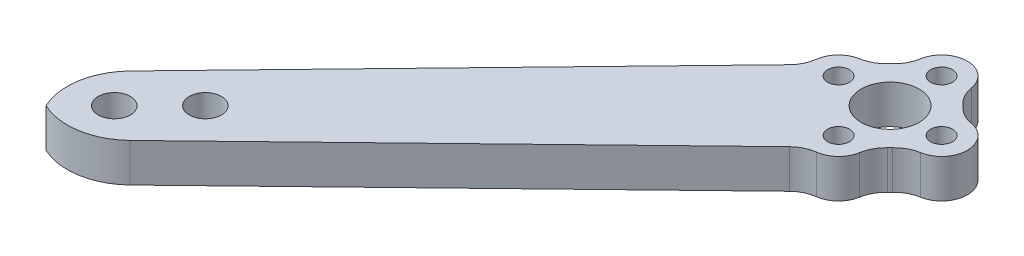
from build123d import *

# Parameters (mm, degrees)
SKETCH2_R               = 1.7
SKETCH2_R_2             = 4.5
BOSS_EXTRUDE1_DEPTH     = 6
FILLET1_R               = 10
CUT_EXTRUDE2_DEPTH      = 138.309868546
CUT_EXTRUDE2_DEPTH_BACK = 138.309868546
SKETCH7_R               = 2.5


with BuildPart() as part:
    # Sketch2 → Boss-Extrude1 (new body)
    with BuildSketch(Plane(origin=(0, 0, 0), x_dir=(1, 0, 0), z_dir=(0, 1, 0))):
        with BuildLine():
            Line((82.701229094, 71.670763572), (23.580603164, 14.468001358))
            Line((23.580603164, 14.468001358), (14.468001358, 23.580603164))
            Line((14.468001358, 23.580603164), (71.670763572, 82.701229094))
            ThreePointArc((71.670763572, 82.701229094), (72.579468699, 84.002771186), (73.034411761, 85.523555075))
            ThreePointArc((73.034411761, 85.523555075), (74.120868496, 87.776797037), (76.333333333, 88.944053189))
            ThreePointArc((76.333333333, 88.944053189), (77.868327334, 89.470595445), (79.153846154, 90.460996723))
            ThreePointArc((79.153846154, 90.460996723), (79.343145751, 90.656854249), (79.539003277, 90.846153846))
            ThreePointArc((79.539003277, 90.846153846), (80.529404555, 92.131672666), (81.055946811, 93.666666667))
            ThreePointArc((81.055946811, 93.666666667), (85, 97), (88.944053189, 93.666666667))
            ThreePointArc((88.944053189, 93.666666667), (89.470595445, 92.131672666), (90.460996723, 90.846153846))
            ThreePointArc((90.460996723, 90.846153846), (90.656854249, 90.656854249), (90.846153846, 90.460996723))
            ThreePointArc((90.846153846, 90.460996723), (92.131672666, 89.470595445), (93.666666667, 88.944053189))
            ThreePointArc((93.666666667, 88.944053189), (97, 85), (93.666666667, 81.055946811))
            ThreePointArc((93.666666667, 81.055946811), (92.131672666, 80.529404555), (90.846153846, 79.539003277))
            ThreePointArc((90.846153846, 79.539003277), (90.656854249, 79.343145751), (90.460996723, 79.153846154))
            ThreePointArc((90.460996723, 79.153846154), (89.470595445, 77.868327334), (88.944053189, 76.333333333))
            ThreePointArc((88.944053189, 76.333333333), (87.776797037, 74.120868496), (85.523555075, 73.034411761))
            ThreePointArc((85.523555075, 73.034411761), (84.002771186, 72.579468699), (82.701229094, 71.670763572))
        make_face()
        with Locations(Location((85, 93, 0), (0, 0, 270))):
            Circle(SKETCH2_R, mode=Mode.SUBTRACT)
        with Locations(Location((93, 85, 0), (0, 0, 270))):
            Circle(SKETCH2_R, mode=Mode.SUBTRACT)
        with Locations(Location((85, 77, 0), (0, 0, 270))):
            Circle(SKETCH2_R, mode=Mode.SUBTRACT)
        with Locations(Location((77, 85, 0), (0, 0, 270))):
            Circle(SKETCH2_R, mode=Mode.SUBTRACT)
        with Locations(Location((85, 85, 0), (0, 0, 270))):
            Circle(SKETCH2_R_2, mode=Mode.SUBTRACT)
    extrude(amount=BOSS_EXTRUDE1_DEPTH)

    # Fillet1
    # the kernel refuses this fillet: 10 mm, written as the material it takes off along each edge
    with BuildSketch(Plane(origin=(23.580603164, -24.591214075, -14.468001358), x_dir=(0.71866742198992, 0, -0.6953539649490483), z_dir=(0, 1, 0)), Plane(origin=(14.468001358, -24.591214075, -23.580603164), x_dir=(0.7071067811865477, 0, 0.7071067811865475), z_dir=(0, 1, 0))) as fillet1_piece_1:
        with BuildLine():
            CenterArc((FILLET1_R * 0.983648563013, FILLET1_R), FILLET1_R, 180.944569645, 89.055430355)
            Line((-FILLET1_R * 0.0162155484343, FILLET1_R * 0.983514896433), (0, 0))
            Line((0, 0), (FILLET1_R * 0.983648563013, 0))
        make_face()
    extrude(amount=55.182428151, mode=Mode.SUBTRACT)

    # Sketch7 → Cut-Extrude2 (cut, two sides: drawn at the far end of the back side and taken through both)
    with BuildSketch(Plane(origin=(0, 0, 0), x_dir=(1, 0, 0), z_dir=(0, 1, 0)).offset(-CUT_EXTRUDE2_DEPTH_BACK)):
        with Locations(Location((24.748737342, 24.748737342, 0), (0, 0, 270))):
            Circle(SKETCH7_R)
        with Locations(Location((31.819805153, 31.819805153, 0), (0, 0, 270))):
            Circle(SKETCH7_R)
    extrude(amount=CUT_EXTRUDE2_DEPTH + CUT_EXTRUDE2_DEPTH_BACK, mode=Mode.SUBTRACT)


solid = part.part
